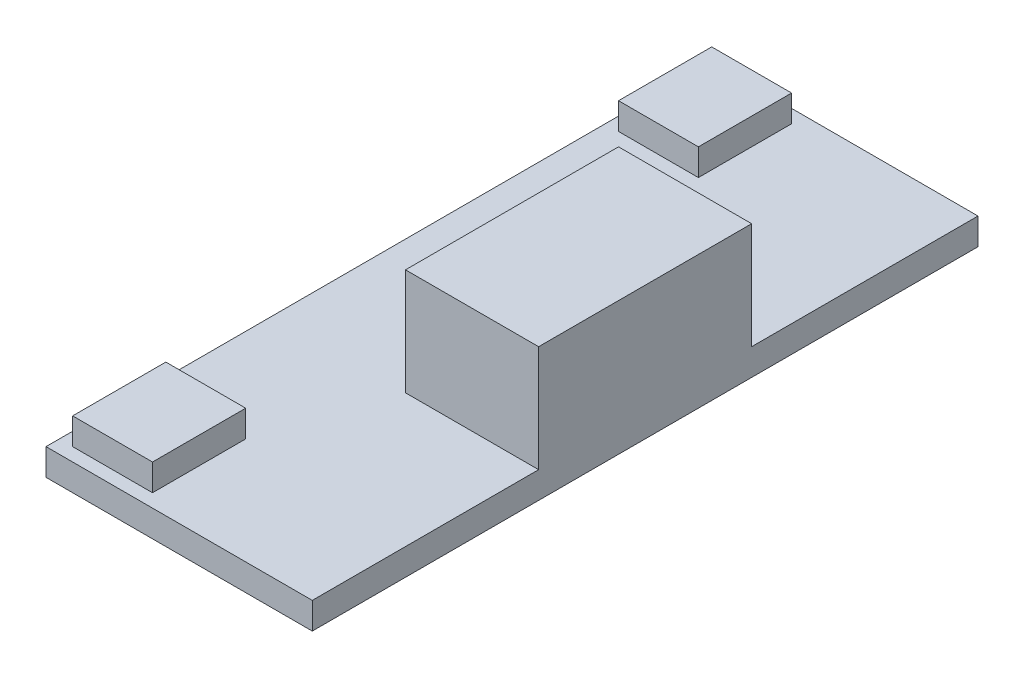
from build123d import *

# Parameters (mm, degrees)
SKETCH1_W           = 10
SKETCH1_H           = 25
BOSS_EXTRUDE1_DEPTH = 1
SKETCH2_W           = 5
SKETCH2_H           = 8
BOSS_EXTRUDE2_DEPTH = 4
SKETCH2_3_W         = 3
SKETCH2_3_H         = 3.5
BOSS_EXTRUDE3_DEPTH = 1


with BuildPart() as part:
    # Sketch1 → Boss-Extrude1 (new body)
    with BuildSketch(Plane(origin=(0, 0, 0), x_dir=(1, 0, 0), z_dir=(0, 1, 0))):
        Rectangle(SKETCH1_W, SKETCH1_H)
    extrude(amount=BOSS_EXTRUDE1_DEPTH)

    # Sketch2 → Boss-Extrude2 (add)
    with BuildSketch(Plane(origin=(0, 1, 0), x_dir=(1, 0, 0), z_dir=(0, 1, 0))):
        with Locations((2.5, 0)):
            Rectangle(SKETCH2_W, SKETCH2_H)
    extrude(amount=BOSS_EXTRUDE2_DEPTH)

    # Sketch2<3> → Boss-Extrude3 (add)
    with BuildSketch(Plane(origin=(0, 1, 0), x_dir=(1, 0, 0), z_dir=(0, 1, 0))):
        with Locations((-3, -10.25)):
            Rectangle(SKETCH2_3_W, SKETCH2_3_H)
        with Locations((-3, 10.25)):
            Rectangle(SKETCH2_3_W, SKETCH2_3_H)
    extrude(amount=BOSS_EXTRUDE3_DEPTH)


solid = part.part
